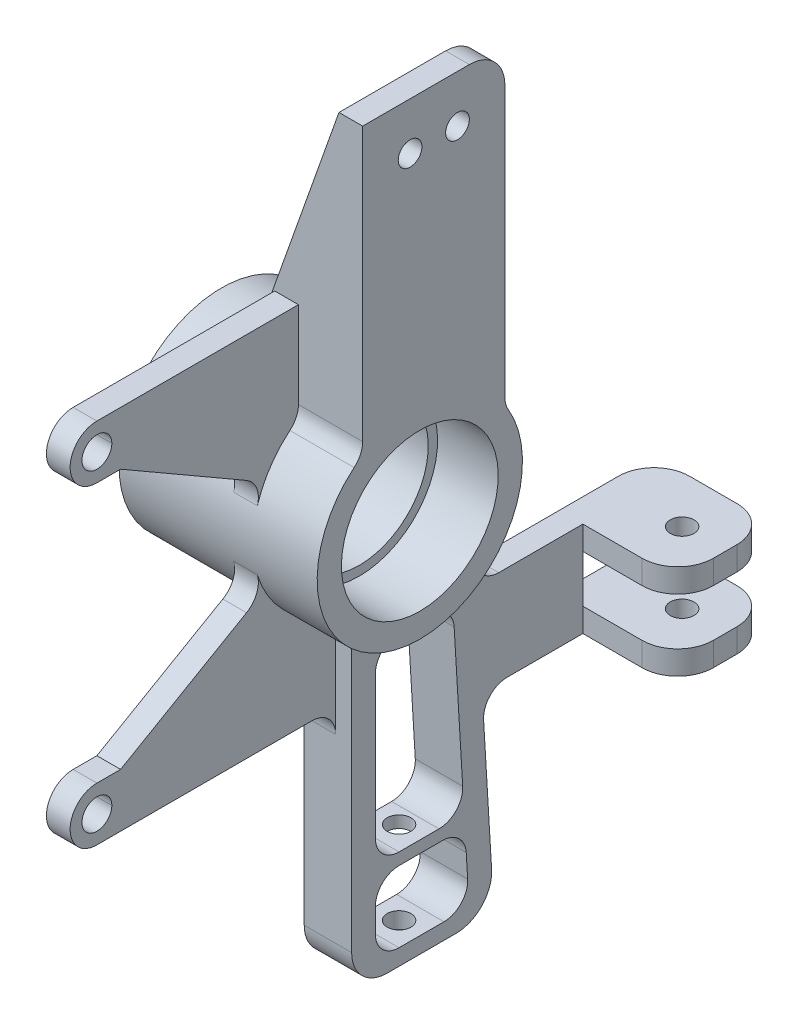
from build123d import *

# Parameters (mm, degrees)
BOSS_EXTRUDE1_START      = -6.35
BOSS_EXTRUDE1_DEPTH      = 6.35
BOSS_EXTRUDE2_DEPTH      = 6.35
BOSS_EXTRUDE2_DEPTH_BACK = 6.35
BOSS_EXTRUDE3_DEPTH      = 6.35
SKETCH6_W                = 25.4
SKETCH6_H                = 6.35
BOSS_EXTRUDE4_DEPTH      = 25.4
BOSS_EXTRUDE5_START      = 25.4
BOSS_EXTRUDE5_DEPTH      = 25.4
BOSS_EXTRUDE6_START      = 6.35
BOSS_EXTRUDE6_DEPTH      = 6.35
CUT_EXTRUDE1_REACH       = 161.579
CUT_EXTRUDE2_REACH       = 147.708
SKETCH14_R               = 3.175
CUT_EXTRUDE3_DEPTH       = 214.767199478
CUT_EXTRUDE4_REACH       = 151.791
SKETCH15_R               = 3.175
SKETCH16_R               = 3.175
CUT_EXTRUDE5_DEPTH       = 171.84284427
BOSS_EXTRUDE7_START      = 6.35
BOSS_EXTRUDE7_DEPTH      = 6.35
F_0_375_FILLET1_R        = 9.525
F_0_25_FILLET1_R         = 6.35


with BuildPart() as part:
    # Sketch1 → Revolve1 (revolve)
    with BuildSketch(Plane.XY, mode=Mode.PRIVATE) as revolve1_sk:
        Polygon((0, 23.5), (16.279070312, 23.5), (16.279070312, 18.5), (36.848222468, 18.5), (36.848222468, 21), (53.090847844, 21), (53.090847844, 27.5), (0, 27.5), align=None)
    revolve(revolve1_sk.sketch.rotate(Axis((0, 0, 0), (1, 0, 0)), 180), axis=Axis((0, 0, 0), (1, 0, 0)))

    # Sketch2 → Boss-Extrude1 (add)
    with BuildSketch(Plane(origin=(53.090847844, 0, 0), x_dir=(0, 0, -1), z_dir=(1, 0, 0)).offset(BOSS_EXTRUDE1_START)):
        with BuildLine():
            Line((22.791687671, 99.207948957), (22.791687671, 15.387948957))
            ThreePointArc((22.791687671, 15.387948957), (5.282335812, 26.987903371), (-15.308312329, 22.84525276))
            Line((-15.308312329, 22.84525276), (-15.308312329, 99.207948957))
            Line((-15.308312329, 99.207948957), (22.791687671, 99.207948957))
        make_face()
    extrude(amount=BOSS_EXTRUDE1_DEPTH)

    # Sketch4 → Boss-Extrude2 (add, two sides: drawn at the far end of the back side and taken through both)
    with BuildSketch(Plane(origin=(33.801584976, 0, 0), x_dir=(0, 0, -1), z_dir=(1, 0, 0)).offset(-BOSS_EXTRUDE2_DEPTH_BACK)):
        with BuildLine():
            Line((26.425369625, -7.612479241), (32.775369625, -113.538))
            Line((32.775369625, -113.538), (-5.324630375, -113.538))
            Line((-5.324630375, -113.538), (-5.324630375, -26.979590645))
            ThreePointArc((-5.324630375, -26.979590645), (14.320668639, -23.476977015), (26.425369625, -7.612479241))
        make_face()
    extrude(amount=BOSS_EXTRUDE2_DEPTH + BOSS_EXTRUDE2_DEPTH_BACK)

    # Sketch5 → Boss-Extrude3 (add)
    with BuildSketch(Plane(origin=(40.151584976, 0, 0), x_dir=(0, 0, -1), z_dir=(1, 0, 0))):
        Polygon((29.623435156, -60.96), (82.023576364, -60.96), (82.023576364, -54.61), (56.623576364, -54.61), (56.623576364, -41.91), (82.023576364, -41.91), (82.023576364, -35.56), (28.1007615, -35.56), align=None)
    extrude(amount=-BOSS_EXTRUDE3_DEPTH)

    # Sketch6 → Boss-Extrude4 (add)
    with BuildSketch(Plane(origin=(40.151584976, 0, 0), x_dir=(0, 0, -1), z_dir=(1, 0, 0))):
        with Locations((69.323576364, -38.735)):
            Rectangle(SKETCH6_W, SKETCH6_H)
        with Locations((69.323576364, -57.785)):
            Rectangle(SKETCH6_W, SKETCH6_H)
    extrude(amount=BOSS_EXTRUDE4_DEPTH)

    # Sketch7 → Boss-Extrude5 (add)
    with BuildSketch(Plane.ZY.offset(-46.740847844).offset(BOSS_EXTRUDE5_START)):
        with BuildLine():
            Line((15.308312329, 22.84525276), (15.308312329, 99.207948957))
            Line((15.308312329, 99.207948957), (8.958312329, 99.207948957))
            Line((8.958312329, 99.207948957), (8.958312329, 25.99997385))
            ThreePointArc((8.958312329, 25.99997385), (12.235413126, 24.62812753), (15.308312329, 22.84525276))
        make_face()
    extrude(amount=-BOSS_EXTRUDE5_DEPTH)

    # Sketch8 → Boss-Extrude6 (add)
    with BuildSketch(Plane.ZY.offset(-35.879535156).offset(BOSS_EXTRUDE6_START)):
        with BuildLine():
            Line((15.308312329, 49.175), (69.3, 49.175))
            ThreePointArc((69.3, 49.175), (76.475, 42), (69.3, 34.825))
            Line((69.3, 34.825), (62.95, 34.825))
            Line((62.95, 34.825), (24.446259855, 12.594855263))
            ThreePointArc((24.446259855, 12.594855263), (20.527400337, 18.299612985), (15.308312329, 22.84525276))
            Line((15.308312329, 22.84525276), (15.308312329, 49.175))
        make_face()
        with BuildLine():
            ThreePointArc((69.3, 38.000000001), (73.299999999, 42), (69.3, 46.000000001))
            ThreePointArc((69.3, 46.000000001), (65.299999999, 42), (69.3, 38.000000001))
        make_face(mode=Mode.SUBTRACT)
    extrude(amount=-BOSS_EXTRUDE6_DEPTH)

    # Sketch10 → Cut-Extrude1 (cut, up to next)
    with BuildSketch(Plane(origin=(0, 0, 8.958312329), x_dir=(-1, 0, 0), z_dir=(0, 0, -1)), mode=Mode.PRIVATE) as cut_extrude1_sk1:
        Polygon((-46.740847844, 99.207948957), (-21.340847844, 27.5), (-21.340847844, 99.207948957), align=None)
    cut_extrude1_tool1 = extrude(cut_extrude1_sk1.sketch, amount=-CUT_EXTRUDE1_REACH, mode=Mode.PRIVATE) & part.part
    add(cut_extrude1_tool1.solids().sort_by_distance((29.807515, 75.305299, 8.958312))[0], mode=Mode.SUBTRACT)

    # Sketch13 → Cut-Extrude2 (cut, up to next)
    with BuildSketch(Plane(origin=(40.151584976, 0, 0), x_dir=(0, 0, -1), z_dir=(1, 0, 0)), mode=Mode.PRIVATE) as cut_extrude2_sk1:
        Polygon((26.155115223, -109.22), (25.01310998, -90.17), (1.025369625, -90.17), (1.025369625, -109.22), align=None)
    cut_extrude2_tool1 = extrude(cut_extrude2_sk1.sketch, amount=-CUT_EXTRUDE2_REACH, mode=Mode.PRIVATE) & part.part
    # Sketch13 → Cut-Extrude2 (cut, up to next)
    with BuildSketch(Plane(origin=(40.151584976, 0, 0), x_dir=(0, 0, -1), z_dir=(1, 0, 0)), mode=Mode.PRIVATE) as cut_extrude2_sk2:
        Polygon((21.77742846, -36.195), (24.822775773, -86.995), (1.025369625, -86.995), (1.025369625, -36.195), align=None)
    cut_extrude2_tool2 = extrude(cut_extrude2_sk2.sketch, amount=-CUT_EXTRUDE2_REACH, mode=Mode.PRIVATE) & part.part
    add(cut_extrude2_tool1.solids().sort_by_distance((40.151585, -99.76882, -13.306954))[0], mode=Mode.SUBTRACT)
    add(cut_extrude2_tool2.solids().sort_by_distance((40.151585, -62.173771, -12.180084))[0], mode=Mode.SUBTRACT)

    # Sketch14 → Cut-Extrude3 (cut, through all)
    with BuildSketch(Plane(origin=(0, -86.995, 0), x_dir=(1, 0, 0), z_dir=(0, 1, 0))):
        with Locations(Location((33.801584976, 13.725369625, 0), (0, 0, 180))):
            Circle(SKETCH14_R)
    extrude(amount=-CUT_EXTRUDE3_DEPTH, mode=Mode.SUBTRACT)

    # Sketch15 → Cut-Extrude4 (cut, up to next)
    with BuildSketch(Plane(origin=(53.090847844, 0, 0), x_dir=(0, 0, -1), z_dir=(1, 0, 0)), mode=Mode.PRIVATE) as cut_extrude4_sk1:
        with Locations(Location((-2.608312329, 86.507948957, 0), (0, 0, 90))):
            Circle(SKETCH15_R)
    cut_extrude4_tool1 = extrude(cut_extrude4_sk1.sketch, amount=-CUT_EXTRUDE4_REACH, mode=Mode.PRIVATE) & part.part
    # Sketch15 → Cut-Extrude4 (cut, up to next)
    with BuildSketch(Plane(origin=(53.090847844, 0, 0), x_dir=(0, 0, -1), z_dir=(1, 0, 0)), mode=Mode.PRIVATE) as cut_extrude4_sk2:
        with Locations(Location((10.091687671, 86.507948957, 0), (0, 0, 90))):
            Circle(SKETCH15_R)
    cut_extrude4_tool2 = extrude(cut_extrude4_sk2.sketch, amount=-CUT_EXTRUDE4_REACH, mode=Mode.PRIVATE) & part.part
    add(cut_extrude4_tool1.solids().sort_by_distance((53.090848, 86.507949, 2.608312))[0], mode=Mode.SUBTRACT)
    add(cut_extrude4_tool2.solids().sort_by_distance((53.090848, 86.507949, -10.091688))[0], mode=Mode.SUBTRACT)

    # Sketch16 → Cut-Extrude5 (cut, through all)
    with BuildSketch(Plane(origin=(0, -35.56, 0), x_dir=(1, 0, 0), z_dir=(0, 1, 0))):
        with Locations(Location((54.032981596, 69.323576364, 0), (0, 0, 180))):
            Circle(SKETCH16_R)
    extrude(amount=-CUT_EXTRUDE5_DEPTH, mode=Mode.SUBTRACT)

    # Sketch9 → Boss-Extrude7 (add)
    with BuildSketch(Plane.ZY.offset(-35.879535156).offset(BOSS_EXTRUDE7_START)):
        with BuildLine():
            Line((5.324630375, -49.174999998), (69.3, -49.174999998))
            ThreePointArc((69.3, -49.174999998), (76.474999998, -42), (69.3, -34.825000002))
            Line((69.3, -34.825000002), (62.95, -34.825000002))
            Line((62.95, -34.825000002), (24.446259854, -12.594855264))
            ThreePointArc((24.446259854, -12.594855264), (16.531988061, -21.975972578), (5.324630375, -26.979590645))
            Line((5.324630375, -26.979590645), (5.324630375, -49.174999998))
        make_face()
        with BuildLine():
            ThreePointArc((69.3, -46.000000001), (73.300000001, -42), (69.3, -38.000000001))
            ThreePointArc((69.3, -38.000000001), (65.300000001, -42), (69.3, -46.000000001))
        make_face(mode=Mode.SUBTRACT)
    extrude(amount=-BOSS_EXTRUDE7_DEPTH)

    # 0.375 Fillet1
    f_0_375_fillet1_edges = [part.edges().sort_by_distance(p)[0] for p in [
        (49.915847844, 99.207948957, -22.791687671),
        (33.801584976, -113.538, 5.324630375),
        (33.801584976, -113.538, -32.775369625),
        (33.801584976, -38.735, -82.023576364),
        (33.801584976, -57.785, -82.023576364),
        (65.551584976, -38.735, -82.023576364),
        (65.551584976, -38.735, -56.623576364),
        (65.551584976, -57.785, -82.023576364),
        (65.551584976, -57.785, -56.623576364),
    ]]
    fillet(f_0_375_fillet1_edges, radius=F_0_375_FILLET1_R)

    # 0.25 Fillet1
    # the kernel refuses this fillet: 6.35 mm, written as the material it adds along each edge
    with BuildSketch(Plane(origin=(40.151584976, -60.96, -29.623435156), x_dir=(0, -0.9982079603765488, -0.05984035294757458), z_dir=(-1, 0, 0))) as f_0_25_fillet1_piece_1:
        with BuildLine():
            CenterArc((F_0_25_FILLET1_R * 1.06174303854, -F_0_25_FILLET1_R), F_0_25_FILLET1_R, 90, 93.4306492)
            Line((F_0_25_FILLET1_R * 0.063535078166, -F_0_25_FILLET1_R * 1.05984035295), (0, 0))
            Line((0, 0), (F_0_25_FILLET1_R * 1.06174303854, 0))
        make_face()
    extrude(amount=6.35)
    with BuildSketch(Plane(origin=(40.151584976, -35.56, -28.1007615), x_dir=(0, 0.9982079603765489, 0.05984035294757479), z_dir=(-1, 0, 0))) as f_0_25_fillet1_piece_2:
        with BuildLine():
            CenterArc((F_0_25_FILLET1_R * 0.941847475047, F_0_25_FILLET1_R), F_0_25_FILLET1_R, 183.4306492, 86.5693508)
            Line((-F_0_25_FILLET1_R * 0.0563604853296, F_0_25_FILLET1_R * 0.940159647052), (0, 0))
            Line((0, 0), (F_0_25_FILLET1_R * 0.941847475047, 0))
        make_face()
    extrude(amount=6.35)
    with BuildSketch(Plane(origin=(21.340847844, 25.99997385, 8.958312329), x_dir=(0, 0.20304997506833786, -0.9791683755232026), z_dir=(1, 0, 0))) as f_0_25_fillet1_piece_3_section:
        with BuildLine():
            CenterArc((7.791231567, 6.298585148), F_0_25_FILLET1_R, 168.284629793, 94.419307905)
            Line((1.573512383, 7.587952489), (0, 0))
            ThreePointArc((0, 0), (3.492402088, 0.222662746), (6.984804176, 0))
        make_face()
    f_0_25_fillet1_piece_3 = extrude(amount=25.4, mode=Mode.PRIVATE)
    f_0_25_fillet1_piece_3 = split(f_0_25_fillet1_piece_3, bisect_by=Plane(origin=(23.013997024, 32.223547088, 7.374495309), z_dir=(0.9426130158079032, -0.33388726005873554, 0)), keep=Keep.TOP, mode=Mode.PRIVATE)
    add(f_0_25_fillet1_piece_3)
    with BuildSketch(Plane(origin=(27.451584976, -7.612479241, -26.425369625), x_dir=(0, 0.9654712583471962, -0.26050959541921204), z_dir=(1, 0, 0))) as f_0_25_fillet1_piece_4:
        with BuildLine():
            CenterArc((1.038638906, -6.34908993), F_0_25_FILLET1_R, 90.970048392, 17.560902681)
            Line((-0.979498363, -0.328324035), (0, 0))
            ThreePointArc((0, 0), (0.465567562, -0.003941249), (0.931135124, 0))
        make_face()
    extrude(amount=12.7)
    with BuildSketch(Plane(origin=(46.740847844, 15.387948957, -22.791687671), x_dir=(0, 1, 0), z_dir=(1, 0, 0))) as f_0_25_fillet1_piece_5:
        with BuildLine():
            CenterArc((1.833681038, -6.35), F_0_25_FILLET1_R, 90, 30.581473676)
            ThreePointArc((-1.396964471, -0.883243229), (-0.691845316, -0.452118768), (0, 0))
            Line((0, 0), (1.833681038, 0))
        make_face()
    extrude(amount=6.35)
    with BuildSketch(Plane(origin=(53.090847844, 22.84525276, 15.308312329), x_dir=(0, -0.5990573223008322, 0.8007061412264532), z_dir=(-1, 0, 0))) as f_0_25_fillet1_piece_6:
        with BuildLine():
            CenterArc((3.186086766, 6.341431143), F_0_25_FILLET1_R, 216.80241312, 50.220708616)
            Line((-1.898397231, 2.537417146), (0, 0))
            ThreePointArc((0, 0), (1.428156252, 0.037109225), (2.856312504, 0))
        make_face()
    extrude(amount=25.133748321)
    with BuildSketch(Plane(origin=(37.451970789, 22.84525276, 15.308312329), x_dir=(0, -0.5990573223008359, 0.8007061412264505), z_dir=(-1, 0, 0))) as f_0_25_fillet1_piece_7:
        with BuildLine():
            CenterArc((3.186086766, 6.341431143), F_0_25_FILLET1_R, 216.80241312, 50.220708616)
            Line((-1.898397231, 2.537417146), (0, 0))
            ThreePointArc((0, 0), (1.428156252, 0.037109225), (2.856312504, 0))
        make_face()
    extrude(amount=16.111122945)
    with BuildSketch(Plane(origin=(29.529535156, 12.594855263, 24.446259855), x_dir=(0, -0.9266302092337214, 0.3759740088562898), z_dir=(1, 0, 0))) as f_0_25_fillet1_piece_8:
        with BuildLine():
            CenterArc((5.531795752, -6.32413382), F_0_25_FILLET1_R, 95.173261718, 76.911263608)
            Line((-0.757703388, -5.449662227), (0, 0))
            ThreePointArc((0, 0), (2.479615048, -0.112018891), (4.959230096, 0))
        make_face()
    extrude(amount=6.35)
    with BuildSketch(Plane(origin=(29.529535156, -12.594855264, 24.446259854), x_dir=(0, 0.9266302092084975, 0.3759740089184572), z_dir=(1, 0, 0))) as f_0_25_fillet1_piece_9:
        with BuildLine():
            CenterArc((5.531795753, 6.32413382), F_0_25_FILLET1_R, 187.91547467, 76.911263612)
            Line((-0.757703387, 5.449662228), (0, 0))
            ThreePointArc((0, 0), (2.479615048, 0.112018891), (4.959230096, 0))
        make_face()
    extrude(amount=6.35)
    with BuildSketch(Plane(origin=(29.529535156, -49.174999998, 5.324630375), x_dir=(0, -1, 0), z_dir=(1, 0, 0))) as f_0_25_fillet1_piece_10:
        with BuildLine():
            CenterArc((F_0_25_FILLET1_R, -F_0_25_FILLET1_R), F_0_25_FILLET1_R, 90, 90)
            Line((0, -F_0_25_FILLET1_R), (0, 0))
            Line((0, 0), (F_0_25_FILLET1_R, 0))
        make_face()
    extrude(amount=6.35)
    with BuildSketch(Plane(origin=(40.151584976, -36.195, -1.025369625), x_dir=(0, -1, 0), z_dir=(-1, 0, 0)), Plane(origin=(40.151584976, -86.995, -1.025369625), x_dir=(0, 0, -1), z_dir=(-1, 0, 0)), Plane(origin=(40.151584976, -109.22, -1.025369625), x_dir=(0, 0, -1), z_dir=(-1, 0, 0)), Plane(origin=(40.151584976, -90.17, -1.025369625), x_dir=(0, -1, 0), z_dir=(-1, 0, 0))) as f_0_25_fillet1_piece_11:
        with BuildLine():
            CenterArc((F_0_25_FILLET1_R, -F_0_25_FILLET1_R), F_0_25_FILLET1_R, 90, 90)
            Line((0, -F_0_25_FILLET1_R), (0, 0))
            Line((0, 0), (F_0_25_FILLET1_R, 0))
        make_face()
    extrude(amount=12.7)
    with BuildSketch(Plane(origin=(40.151584976, -36.195, -21.77742846), x_dir=(0, -0.9982079603765489, -0.05984035294757416), z_dir=(-1, 0, 0))) as f_0_25_fillet1_piece_12:
        with BuildLine():
            CenterArc((F_0_25_FILLET1_R * 0.941847475047, F_0_25_FILLET1_R), F_0_25_FILLET1_R, 183.4306492, 86.5693508)
            Line((-F_0_25_FILLET1_R * 0.0563604853296, F_0_25_FILLET1_R * 0.940159647052), (0, 0))
            Line((0, 0), (F_0_25_FILLET1_R * 0.941847475047, 0))
        make_face()
    extrude(amount=12.7)
    with BuildSketch(Plane(origin=(40.151584976, -86.995, -24.822775773), x_dir=(0, 0.9982079603765488, 0.05984035294757458), z_dir=(-1, 0, 0))) as f_0_25_fillet1_piece_13:
        with BuildLine():
            CenterArc((F_0_25_FILLET1_R * 1.06174303854, -F_0_25_FILLET1_R), F_0_25_FILLET1_R, 90, 93.4306492)
            Line((F_0_25_FILLET1_R * 0.063535078166, -F_0_25_FILLET1_R * 1.05984035295), (0, 0))
            Line((0, 0), (F_0_25_FILLET1_R * 1.06174303854, 0))
        make_face()
    extrude(amount=12.7)
    with BuildSketch(Plane(origin=(40.151584976, -109.22, -26.155115223), x_dir=(0, 0, 1), z_dir=(-1, 0, 0))) as f_0_25_fillet1_piece_14:
        with BuildLine():
            CenterArc((F_0_25_FILLET1_R * 1.06174303854, F_0_25_FILLET1_R), F_0_25_FILLET1_R, 176.5693508, 93.4306492)
            Line((F_0_25_FILLET1_R * 0.063535078166, F_0_25_FILLET1_R * 1.05984035295), (0, 0))
            Line((0, 0), (F_0_25_FILLET1_R * 1.06174303854, 0))
        make_face()
    extrude(amount=12.7)
    with BuildSketch(Plane(origin=(40.151584976, -90.17, -25.01310998), x_dir=(0, 0, 1), z_dir=(-1, 0, 0))) as f_0_25_fillet1_piece_15:
        with BuildLine():
            CenterArc((F_0_25_FILLET1_R * 0.941847475047, -F_0_25_FILLET1_R), F_0_25_FILLET1_R, 90, 86.5693508)
            Line((-F_0_25_FILLET1_R * 0.0563604853296, -F_0_25_FILLET1_R * 0.940159647052), (0, 0))
            Line((0, 0), (F_0_25_FILLET1_R * 0.941847475047, 0))
        make_face()
    extrude(amount=12.7)


solid = part.part
